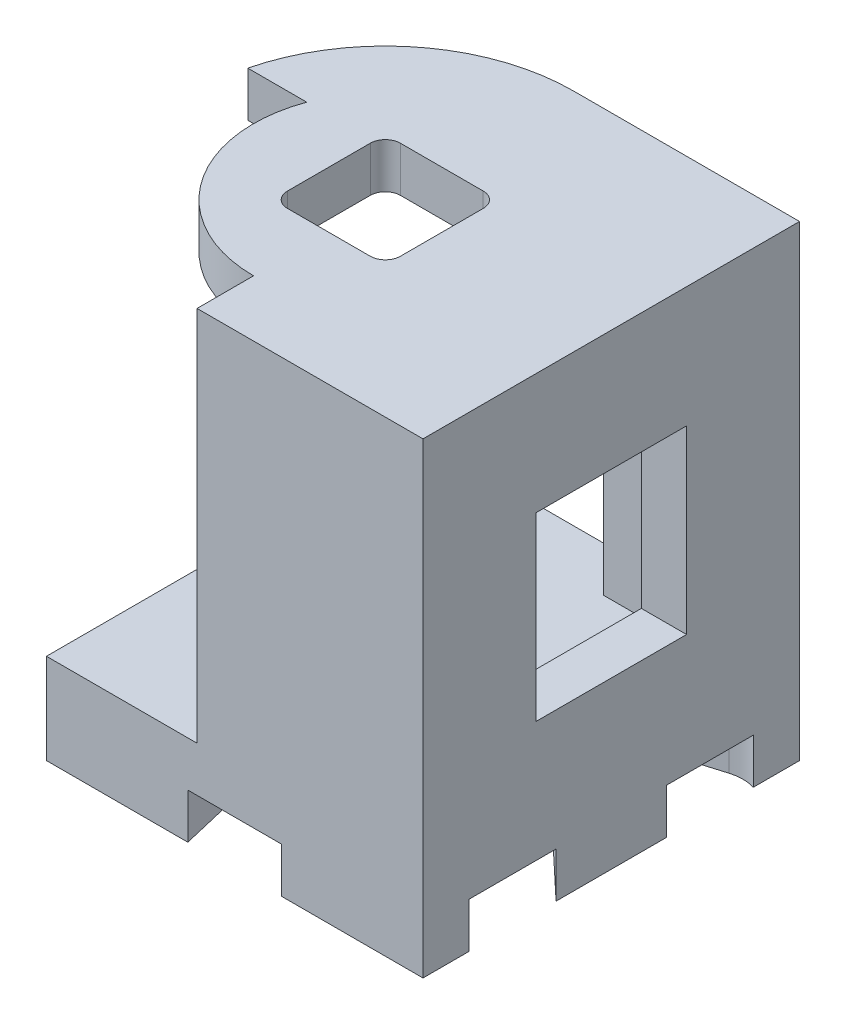
from build123d import *

# Parameters (mm, degrees)
SKETCH1_W           = 30
SKETCH1_H           = 25
SKETCH1_W_2         = 7.5
SKETCH1_H_2         = 7.5
BOSS_EXTRUDE1_DEPTH = 3
FILLET1_R           = 1
CUT_EXTRUDE1_DEPTH  = 20.754746265
BOSS_EXTRUDE2_DEPTH = 31
SKETCH5_W           = 25
SKETCH5_H           = 6
BOSS_EXTRUDE3_DEPTH = 25
CUT_EXTRUDE2_DEPTH  = 3
CIRPATTERN1_COUNT   = 6
SKETCH8_W           = 10
SKETCH8_H           = 12
CUT_EXTRUDE3_DEPTH  = 41.945571592


with BuildPart() as part:
    # Sketch1 → Boss-Extrude1 (new body)
    with BuildSketch(Plane(origin=(0, 0, 0), x_dir=(1, 0, 0), z_dir=(0, 1, 0))):
        Rectangle(SKETCH1_W, SKETCH1_H)
        Rectangle(SKETCH1_W_2, SKETCH1_H_2, mode=Mode.SUBTRACT)
    extrude(amount=BOSS_EXTRUDE1_DEPTH)

    # Fillet1
    fillet1_edges = [part.edges().sort_by_distance(p)[0] for p in [
        (3.75, 1.5, 3.75),
        (3.75, 1.5, -3.75),
        (-3.75, 1.5, -3.75),
        (-3.75, 1.5, 3.75),
    ]]
    fillet(fillet1_edges, radius=FILLET1_R)

    # Sketch2 → Cut-Extrude1 (cut, through all)
    with BuildSketch(Plane(origin=(0, 0, 0), x_dir=(-1, 0, 0), z_dir=(0, -1, 0))):
        with BuildLine():
            Line((8.219641111, 3), (12.1346611, 3))
            ThreePointArc((12.1346611, 3), (7.705517504, 9.842509843), (0, 12.5))
            Line((0, 12.5), (15, 12.5))
            Line((15, 12.5), (15, -12.5))
            Line((15, -12.5), (0, -12.5))
            Line((0, -12.5), (0, -8.75))
            ThreePointArc((0, -8.75), (7.1698152, -5.015600662), (8.219641111, 3))
        make_face()
    extrude(amount=-CUT_EXTRUDE1_DEPTH, mode=Mode.SUBTRACT)

    # Sketch3 → Boss-Extrude2 (add)
    with BuildSketch(Plane(origin=(0, 3, 0), x_dir=(1, 0, 0), z_dir=(0, 1, 0))):
        Polygon((15, -12.5), (15, 12.5), (5, 12.5), (5, 9.5), (12, 9.5), (12, -9.5), (0, -9.5), (0, -12.5), align=None)
    extrude(amount=-BOSS_EXTRUDE2_DEPTH)

    # Sketch5 → Boss-Extrude3 (add)
    with BuildSketch(Plane(origin=(15, 0, 0), x_dir=(0, 0, -1), z_dir=(1, 0, 0))):
        with Locations((0, -25)):
            Rectangle(SKETCH5_W, SKETCH5_H)
    extrude(amount=-BOSS_EXTRUDE3_DEPTH)

    # Sketch6 → Cut-Extrude2 (cut)
    with BuildSketch(Plane.XZ.offset(28)):
        with BuildLine():
            Line((-0.225034788, 14.143572378), (-2.0730069, 6.31882963))
            ThreePointArc((-2.0730069, 6.31882963), (2.5, -7.8), (7.0730069, 6.31882963))
            Line((7.0730069, 6.31882963), (5.225034788, 14.143572378))
            ThreePointArc((5.225034788, 14.143572378), (2.5, 16.3), (-0.225034788, 14.143572378))
        make_face()
    cut_extrude2 = extrude(amount=-CUT_EXTRUDE2_DEPTH, mode=Mode.SUBTRACT)

    # CirPattern1: Cut-Extrude2 ×6 about axis
    cirpattern1_axis = Axis((2.5, -25, 0), (0, -1, 0))
    for i in range(1, CIRPATTERN1_COUNT):
        add(cut_extrude2.rotate(cirpattern1_axis, i * 360 / CIRPATTERN1_COUNT), mode=Mode.SUBTRACT)

    # Sketch8 → Cut-Extrude3 (cut, through all)
    with BuildSketch(Plane(origin=(15, 0, 0), x_dir=(0, 0, -1), z_dir=(1, 0, 0))):
        with Locations((0, -11)):
            Rectangle(SKETCH8_W, SKETCH8_H)
    extrude(amount=-CUT_EXTRUDE3_DEPTH, mode=Mode.SUBTRACT)


solid = part.part
